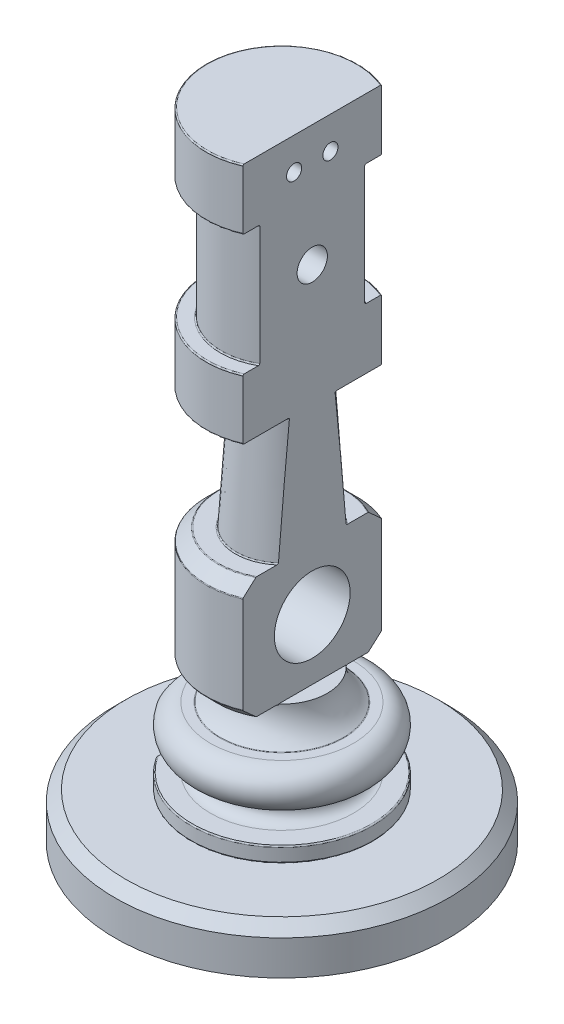
from build123d import *

# Parameters (mm, degrees)
CHAMFER1_SIZE      = 1.27
CUT_EXTRUDE1_START = -50.800001
SKETCH3_W          = 12.7
SKETCH3_H          = 25.4
CUT_EXTRUDE1_DEPTH = 50.800001
SKETCH4_R          = 3.96875
SKETCH4_R_2        = 1.5875
CUT_EXTRUDE2_DEPTH = 49.214693784
CUT_EXTRUDE4_START = -6.35
SKETCH5_R          = 3.175
CUT_EXTRUDE4_DEPTH = 42.864693784
SKETCH6_W          = 12.7
SKETCH6_H          = 25.4
CUT_EXTRUDE5_DEPTH = 11.1125
SKETCH8_R          = 0.79375
CUT_EXTRUDE7_DEPTH = 49.214693784
SKETCH8_3_R        = 0.79375
CUT_EXTRUDE8_DEPTH = 7.9375
FILLET1_R          = 0.127


with BuildPart() as part:
    # Sketch1 → Revolve1 (revolve)
    with BuildSketch(Plane(origin=(0, 0, 0), x_dir=(0, 0, -1), z_dir=(1, 0, 0))):
        with BuildLine():
            Line((0, 26.752432646), (-7.9375, 26.752432646))
            Line((-7.9375, 26.752432646), (-7.9375, 20.402432646))
            Line((-7.9375, 20.402432646), (-6.35, 20.402432646))
            Line((-6.35, 20.402432646), (-6.35, 7.702432646))
            Line((-6.35, 7.702432646), (-7.9375, 7.702432646))
            Line((-7.9375, 7.702432646), (-7.9375, 1.352432646))
            Line((-7.9375, 1.352432646), (-3.96875, 1.352432646))
            Line((-3.96875, 1.352432646), (-4.7625, -11.347567354))
            Line((-4.7625, -11.347567354), (-7.9375, -11.347567354))
            Line((-7.9375, -11.347567354), (-7.9375, -24.047567354))
            Line((-7.9375, -24.047567354), (-4.7625, -24.047567354))
            ThreePointArc((-4.7625, -24.047567354), (-5.218401388, -25.854809037), (-6.477, -27.229544688))
            Line((-6.477, -27.229544688), (-7.493, -27.229544688))
            ThreePointArc((-7.493, -27.229544688), (-9.525, -29.261544688), (-7.493, -31.293544688))
            ThreePointArc((-7.493, -31.293544688), (-6.353488667, -32.433056021), (-7.493, -33.572567354))
            Line((-7.493, -33.572567354), (-9.525, -33.572567354))
            Line((-9.525, -33.572567354), (-9.525, -35.160067354))
            Line((-9.525, -35.160067354), (-4.7625, -35.160067354))
            Line((-4.7625, -35.160067354), (-4.7625, -39.922567354))
            Line((-4.7625, -39.922567354), (0, -39.922567354))
            Line((0, -39.922567354), (0, 26.752432646))
        make_face()
    revolve(axis=Axis((0, 26.752432646, 0), (0, -1, 0)))

    # Chamfer1
    chamfer1_edges = [part.edges().sort_by_distance(p)[0] for p in [
        (0, -11.347567354, -7.9375),
        (0, -24.047567354, -7.9375),
    ]]
    chamfer(chamfer1_edges, length=CHAMFER1_SIZE)

    # Sketch3 → Cut-Extrude1 (cut)
    with BuildSketch(Plane(origin=(0, 26.752432646, 0), x_dir=(1, 0, 0), z_dir=(0, 1, 0)).offset(CUT_EXTRUDE1_START)):
        with Locations((9.525, 0)):
            Rectangle(SKETCH3_W, SKETCH3_H)
    extrude(amount=CUT_EXTRUDE1_DEPTH, mode=Mode.SUBTRACT)

    # Sketch4 → Cut-Extrude2 (cut, through all)
    with BuildSketch(Plane(origin=(3.175, 0, 0), x_dir=(0, 0, -1), z_dir=(1, 0, 0))):
        with Locations((0, -17.697567354)):
            Circle(SKETCH4_R)
        with Locations((0, 14.052432646)):
            Circle(SKETCH4_R_2)
    extrude(amount=-CUT_EXTRUDE2_DEPTH, mode=Mode.SUBTRACT)

    # Sketch5 → Cut-Extrude4 (cut, through all)
    with BuildSketch(Plane(origin=(3.175, 0, 0), x_dir=(0, 0, -1), z_dir=(1, 0, 0)).offset(CUT_EXTRUDE4_START)):
        with Locations((0, 14.052432646)):
            Circle(SKETCH5_R)
    extrude(amount=-CUT_EXTRUDE4_DEPTH, mode=Mode.SUBTRACT)

    # Sketch6 → Cut-Extrude5 (cut)
    with BuildSketch(Plane(origin=(0, -35.160067354, 0), x_dir=(1, 0, 0), z_dir=(0, 1, 0))):
        with Locations((-14.2875, -2.385413715)):
            Rectangle(SKETCH6_W, SKETCH6_H)
    extrude(amount=CUT_EXTRUDE5_DEPTH, mode=Mode.SUBTRACT)

    # Sketch8 → Cut-Extrude7 (cut, through all)
    with BuildSketch(Plane(origin=(3.175, 0, 0), x_dir=(0, 0, -1), z_dir=(1, 0, 0))):
        with Locations((-1.90373, 23.384392646)):
            Circle(SKETCH8_R)
    extrude(amount=-CUT_EXTRUDE7_DEPTH, mode=Mode.SUBTRACT)

    # Sketch8<3> → Cut-Extrude8 (cut)
    with BuildSketch(Plane(origin=(3.175, 0, 0), x_dir=(0, 0, -1), z_dir=(1, 0, 0))):
        with Locations(Location((1.90373, 23.384392646, 0), (0, 0, 180))):
            Circle(SKETCH8_3_R)
    extrude(amount=-CUT_EXTRUDE8_DEPTH, mode=Mode.SUBTRACT)

    # Fillet1
    # the kernel refuses this fillet: 0.127 mm, written as the material it adds along each edge
    with BuildSketch(Plane(origin=(0, -11.347567354, 0), x_dir=(0.7121626545101393, 0, 0.7020144966601988), z_dir=(0.7020144966601988, 0, -0.7121626545101393))) as fillet1_piece_1_section:
        with BuildLine():
            CenterArc((4.7625 + FILLET1_R * 0.939451221368, -FILLET1_R), FILLET1_R, 90, 86.423665625)
            Line((4.7625 - FILLET1_R * 0.0586013571153, -FILLET1_R * 0.937621713845), (4.7625, 0))
            Line((4.7625, 0), (4.7625 + FILLET1_R * 0.939451221368, 0))
        make_face()
    fillet1_piece_1 = revolve(axis=Axis((0, -11.347567354, 0), (0, -1, 0)), revolution_arc=270.822296745, mode=Mode.PRIVATE)
    fillet1_piece_1 = split(fillet1_piece_1, bisect_by=Plane(origin=(3.175, -11.31606909, 0), z_dir=(-1, 0, 0)), keep=Keep.TOP, mode=Mode.PRIVATE)
    add(fillet1_piece_1)
    with BuildSketch(Plane(origin=(0, -27.229544688, 0), x_dir=(0, 0, 1), z_dir=(1, 0, 0))) as fillet1_piece_2:
        with BuildLine():
            CenterArc((6.515414077, -0.127), FILLET1_R, 90, 33.954572122)
            Line((6.515414077, 0), (6.477, 0))
            ThreePointArc((6.477, 0), (6.46071228, -0.010786291), (6.44448008, -0.021655954))
        make_face()
    revolve(axis=Axis((0, -27.229544688, 0), (0, -1, 0)))
    with BuildSketch(Plane(origin=(0, -24.047567354, 0), x_dir=(0, 0, 1), z_dir=(1, 0, 0))) as fillet1_piece_3_section:
        with BuildLine():
            CenterArc((4.891690306, 0.127), FILLET1_R, 178.023891714, 91.976108286)
            ThreePointArc((4.764765834, 0.13137931), (4.763066501, 0.065699424), (4.7625, 0))
            Line((4.7625, 0), (4.891690306, 0))
        make_face()
    fillet1_piece_3 = revolve(axis=Axis((0, -24.047567354, 0), (0, -1, 0)), revolution_arc=225.771992273, mode=Mode.PRIVATE)
    fillet1_piece_3 = split(fillet1_piece_3, bisect_by=Plane(origin=(3.175, -24.047567854, 4.827095153), z_dir=(-1, 0, 0)), keep=Keep.TOP, mode=Mode.PRIVATE)
    add(fillet1_piece_3)
    with BuildSketch(Plane(origin=(0, 1.352432646, 0), x_dir=(0.8483168194298786, 0, 0.5294889742689405), z_dir=(0.5294889742689405, 0, -0.8483168194298786))) as fillet1_piece_4_section:
        with BuildLine():
            CenterArc((3.96875 + FILLET1_R * 1.06445122137, FILLET1_R), FILLET1_R, 176.423665625, 93.576334375)
            Line((3.96875 + FILLET1_R * 1.06445122137, 0), (3.96875, 0))
            Line((3.96875, 0), (3.96875 + FILLET1_R * 0.0663986428847, FILLET1_R * 1.06237828616))
        make_face()
    fillet1_piece_4 = revolve(axis=Axis((0, 1.352432646, 0), (0, -1, 0)), revolution_arc=296.058133243, mode=Mode.PRIVATE)
    fillet1_piece_4 = split(fillet1_piece_4, bisect_by=Plane(origin=(3.175, 1.315334218, 0), z_dir=(-1, 0, 0)), keep=Keep.TOP, mode=Mode.PRIVATE)
    add(fillet1_piece_4)
    with BuildSketch(Plane(origin=(0, 7.702432646, 0), x_dir=(0.542778531555598, 0, 0.8398758632573916), z_dir=(0.8398758632573916, 0, -0.542778531555598))) as fillet1_piece_5_section:
        with BuildLine():
            CenterArc((6.35 + FILLET1_R, -FILLET1_R), FILLET1_R, 90, 90)
            Line((6.35, -FILLET1_R), (6.35, 0))
            Line((6.35, 0), (6.35 + FILLET1_R, 0))
        make_face()
    fillet1_piece_5 = revolve(axis=Axis((0, 7.702432646, 0), (0, -1, 0)), revolution_arc=245.745973182, mode=Mode.PRIVATE)
    fillet1_piece_5 = split(fillet1_piece_5, bisect_by=Plane(origin=(3.175, 7.736434207, 0), z_dir=(-1, 0, 0)), keep=Keep.TOP, mode=Mode.PRIVATE)
    add(fillet1_piece_5)
    with BuildSketch(Plane(origin=(0, 20.402432646, 0), x_dir=(0.542778531555598, 0, 0.8398758632573916), z_dir=(0.8398758632573916, 0, -0.542778531555598))) as fillet1_piece_6_section:
        with BuildLine():
            CenterArc((6.35 + FILLET1_R, FILLET1_R), FILLET1_R, 180, 90)
            Line((6.35 + FILLET1_R, 0), (6.35, 0))
            Line((6.35, 0), (6.35, FILLET1_R))
        make_face()
    fillet1_piece_6 = revolve(axis=Axis((0, 20.402432646, 0), (0, -1, 0)), revolution_arc=245.745973182, mode=Mode.PRIVATE)
    fillet1_piece_6 = split(fillet1_piece_6, bisect_by=Plane(origin=(3.175, 20.368431085, 0), z_dir=(-1, 0, 0)), keep=Keep.TOP, mode=Mode.PRIVATE)
    add(fillet1_piece_6)
    with BuildSketch(Plane(origin=(0, -24.047567354, 0), x_dir=(0.7164563295097723, 0, 0.6976319430081915), z_dir=(0.6976319430081915, 0, -0.7164563295097723))) as fillet1_piece_7_section:
        with BuildLine():
            CenterArc((4.891690306, 0.127), FILLET1_R, 178.023891714, 91.976108286)
            ThreePointArc((4.764765834, 0.13137931), (4.763066501, 0.065699424), (4.7625, 0))
            Line((4.7625, 0), (4.891690306, 0))
        make_face()
    fillet1_piece_7 = revolve(axis=Axis((0, -24.047567354, 0), (0, -1, 0)), revolution_arc=45.762678127, mode=Mode.PRIVATE)
    fillet1_piece_7 = split(fillet1_piece_7, bisect_by=Plane(origin=(3.175, -24.047567861, 4.599758755), z_dir=(-1, 0, 0)), keep=Keep.TOP, mode=Mode.PRIVATE)
    add(fillet1_piece_7)
    # the kernel refuses this fillet: 0.127 mm, written as the material it takes off along each edge
    with BuildSketch(Plane(origin=(0, -11.347567354, 0), x_dir=(0.49348908571216504, 0, -0.869751988950282), z_dir=(0.869751988950282, 0, 0.49348908571216504))) as fillet1_2_piece_1:
        with BuildLine():
            CenterArc((6.6675 - FILLET1_R * 0.414213562373, -FILLET1_R), FILLET1_R, 45, 45)
            Line((6.6675 + FILLET1_R * 0.292893218813, -FILLET1_R * 0.292893218813), (6.6675, 0))
            Line((6.6675, 0), (6.6675 - FILLET1_R * 0.414213562373, 0))
        make_face()
    revolve(axis=Axis((0, -11.347567354, 0), (0, 1, 0)), revolution_arc=239.140336402, mode=Mode.SUBTRACT)
    with BuildSketch(Plane(origin=(0, -12.617567354, 0), x_dir=(0.4151683545293839, 0, -0.9097446000924456), z_dir=(0.9097446000924456, 0, 0.4151683545293839))) as fillet1_2_piece_2:
        with BuildLine():
            CenterArc((7.9375 - FILLET1_R, -FILLET1_R * 0.414213562373), FILLET1_R, 0, 45)
            Line((7.9375, -FILLET1_R * 0.414213562373), (7.9375, 0))
            Line((7.9375, 0), (7.9375 - FILLET1_R * 0.292893218813, FILLET1_R * 0.292893218813))
        make_face()
    revolve(axis=Axis((0, -12.617567354, 0), (0, 1, 0)), revolution_arc=229.059838032, mode=Mode.SUBTRACT)
    with BuildSketch(Plane(origin=(0, -35.160067354, 0), x_dir=(-0.8513672922955307, 0, 0.5245700464279072), z_dir=(-0.5245700464279072, 0, -0.8513672922955307))) as fillet1_2_piece_3:
        with BuildLine():
            CenterArc((9.525 - FILLET1_R, FILLET1_R), FILLET1_R, 270, 90)
            Line((9.525, FILLET1_R), (9.525, 0))
            Line((9.525, 0), (9.525 - FILLET1_R, 0))
        make_face()
    revolve(axis=Axis((0, -35.160067354, 0), (0, 1, 0)), revolution_arc=296.721393001, mode=Mode.SUBTRACT)
    with BuildSketch(Plane(origin=(0, -33.572567354, 0), x_dir=(-0.8513672922955202, 0, 0.5245700464279238), z_dir=(-0.5245700464279238, 0, -0.8513672922955202))) as fillet1_2_piece_4:
        with BuildLine():
            CenterArc((9.525 - FILLET1_R, -FILLET1_R), FILLET1_R, 0, 90)
            Line((9.525, -FILLET1_R), (9.525, 0))
            Line((9.525, 0), (9.525 - FILLET1_R, 0))
        make_face()
    revolve(axis=Axis((0, -33.572567354, 0), (0, 1, 0)), revolution_arc=296.721393001, mode=Mode.SUBTRACT)
    with BuildSketch(Plane(origin=(0, -24.047567354, 0), x_dir=(0.49348908571216554, 0, 0.8697519889502816), z_dir=(0.8697519889502816, 0, -0.49348908571216554))) as fillet1_2_piece_5:
        with BuildLine():
            CenterArc((6.6675 - FILLET1_R * 0.414213562373, -FILLET1_R), FILLET1_R, 45, 45)
            Line((6.6675 - FILLET1_R * 0.414213562373, 0), (6.6675, 0))
            Line((6.6675, 0), (6.6675 + FILLET1_R * 0.292893218813, -FILLET1_R * 0.292893218813))
        make_face()
    revolve(axis=Axis((0, -24.047567354, 0), (0, -1, 0)), revolution_arc=239.140336402, mode=Mode.SUBTRACT)
    with BuildSketch(Plane(origin=(0, -22.777567354, 0), x_dir=(0.4151683545293844, 0, -0.9097446000924454), z_dir=(0.9097446000924454, 0, 0.4151683545293844))) as fillet1_2_piece_6:
        with BuildLine():
            CenterArc((7.9375 - FILLET1_R, FILLET1_R * 0.414213562373), FILLET1_R, 315, 45)
            Line((7.9375 - FILLET1_R * 0.292893218813, -FILLET1_R * 0.292893218813), (7.9375, 0))
            Line((7.9375, 0), (7.9375, FILLET1_R * 0.414213562373))
        make_face()
    revolve(axis=Axis((0, -22.777567354, 0), (0, 1, 0)), revolution_arc=229.059838032, mode=Mode.SUBTRACT)
    with BuildSketch(Plane(origin=(0, 1.352432646, 0), x_dir=(0.4364231130350354, 0, 0.8997415553417596), z_dir=(0.8997415553417596, 0, -0.4364231130350354))) as fillet1_2_piece_7:
        with BuildLine():
            CenterArc((7.9375 - FILLET1_R, -FILLET1_R), FILLET1_R, 0, 90)
            Line((7.9375, -FILLET1_R), (7.9375, 0))
            Line((7.9375, 0), (7.9375 - FILLET1_R, 0))
        make_face()
    revolve(axis=Axis((0, 1.352432646, 0), (0, -1, 0)), revolution_arc=231.751766785, mode=Mode.SUBTRACT)
    with BuildSketch(Plane(origin=(0, 7.702432646, 0), x_dir=(0.4364231130350353, 0, 0.8997415553417598), z_dir=(0.8997415553417598, 0, -0.4364231130350353))) as fillet1_2_piece_8:
        with BuildLine():
            CenterArc((7.9375 - FILLET1_R, FILLET1_R), FILLET1_R, 270, 90)
            Line((7.9375 - FILLET1_R, 0), (7.9375, 0))
            Line((7.9375, 0), (7.9375, FILLET1_R))
        make_face()
    revolve(axis=Axis((0, 7.702432646, 0), (0, -1, 0)), revolution_arc=231.751766785, mode=Mode.SUBTRACT)
    with BuildSketch(Plane(origin=(0, 20.402432646, 0), x_dir=(0.4364231130350352, 0, 0.8997415553417597), z_dir=(0.8997415553417597, 0, -0.4364231130350352))) as fillet1_2_piece_9:
        with BuildLine():
            CenterArc((7.9375 - FILLET1_R, -FILLET1_R), FILLET1_R, 0, 90)
            Line((7.9375, -FILLET1_R), (7.9375, 0))
            Line((7.9375, 0), (7.9375 - FILLET1_R, 0))
        make_face()
    revolve(axis=Axis((0, 20.402432646, 0), (0, -1, 0)), revolution_arc=231.751766785, mode=Mode.SUBTRACT)
    with BuildSketch(Plane(origin=(0, 26.752432646, 0), x_dir=(0.43642311303500736, 0, 0.8997415553417732), z_dir=(0.8997415553417732, 0, -0.43642311303500736))) as fillet1_2_piece_10:
        with BuildLine():
            CenterArc((7.9375 - FILLET1_R, FILLET1_R), FILLET1_R, 270, 90)
            Line((7.9375 - FILLET1_R, 0), (7.9375, 0))
            Line((7.9375, 0), (7.9375, FILLET1_R))
        make_face()
    revolve(axis=Axis((0, 26.752432646, 0), (0, -1, 0)), revolution_arc=231.751766785, mode=Mode.SUBTRACT)


with BuildPart() as body_2:
    # Sketch2 → Revolve2 (revolve)
    with BuildSketch(Plane(origin=(0, 0, 0), x_dir=(0, 0, -1), z_dir=(1, 0, 0)), mode=Mode.PRIVATE) as revolve2_sk:
        Polygon((-4.7625, -39.922567354), (-17.4625, -39.922567354), (-17.4625, -36.282599369), (-16.339967985, -35.160067354), (-4.7625, -35.160067354), align=None)
    revolve(revolve2_sk.sketch.rotate(Axis((0, -39.922567354, 0), (0, 1, 0)), 180), axis=Axis((0, -39.922567354, 0), (0, 1, 0)))


solid = Compound([part.part, body_2.part])
